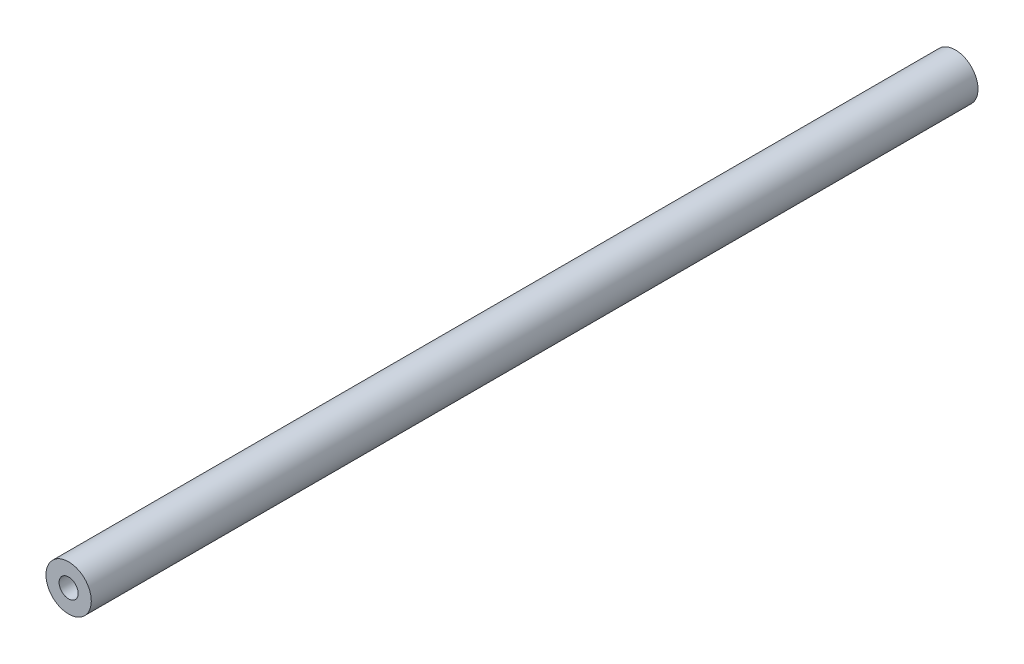
from build123d import *

# Parameters (mm, degrees)
SKETCH1_R                  = 5
BOSS_EXTRUDE1_DEPTH        = 195.6
OTW_R_GWINTOWANY_M52_D     = 4.2
OTW_R_GWINTOWANY_M52_DEPTH = 20
OTW_R_GWINTOWANY_M52_TIP   = 1.2618073
OTW_R_GWINTOWANY_M51_D     = 4.2
OTW_R_GWINTOWANY_M51_DEPTH = 20
OTW_R_GWINTOWANY_M51_TIP   = 1.2618073


with BuildPart() as part:
    # Sketch1 → Boss-Extrude1 (new body)
    with BuildSketch(Plane.XY):
        Circle(SKETCH1_R)
    extrude(amount=BOSS_EXTRUDE1_DEPTH)

    # Otwór gwintowany M52
    with Locations(Plane(origin=(0, 0, 0), x_dir=(-1, 0, 0), z_dir=(0, 0, -1))):
        with Locations((0, 0)):
            Hole(OTW_R_GWINTOWANY_M52_D / 2, depth=OTW_R_GWINTOWANY_M52_DEPTH)
            with Locations((0, 0, -(OTW_R_GWINTOWANY_M52_DEPTH + OTW_R_GWINTOWANY_M52_TIP / 2))):  # 118° drill point
                Cone(0, OTW_R_GWINTOWANY_M52_D / 2, OTW_R_GWINTOWANY_M52_TIP, mode=Mode.SUBTRACT)

    # Otwór gwintowany M51
    with Locations(Plane.XY.offset(195.6)):
        with Locations((0, 0)):
            Hole(OTW_R_GWINTOWANY_M51_D / 2, depth=OTW_R_GWINTOWANY_M51_DEPTH)
            with Locations((0, 0, -(OTW_R_GWINTOWANY_M51_DEPTH + OTW_R_GWINTOWANY_M51_TIP / 2))):  # 118° drill point
                Cone(0, OTW_R_GWINTOWANY_M51_D / 2, OTW_R_GWINTOWANY_M51_TIP, mode=Mode.SUBTRACT)


solid = part.part
